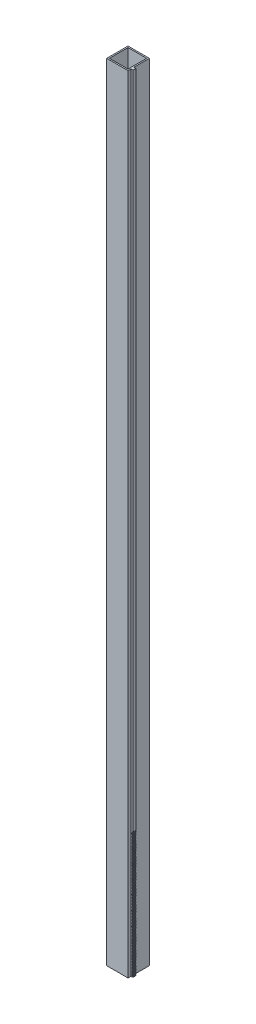
from build123d import *

# Parameters (mm, degrees)
SKETCH1_W            = 50.8
SKETCH1_H            = 50.8
BOSS_EXTRUDE1_DEPTH  = 1873.25
SHELL1_T             = -3.175
SKETCH3_W            = 7
SKETCH3_H            = 1873.25
BOSS_EXTRUDE2_DEPTH  = 5
CUT_EXTRUDE1_REACH   = 1876.302
LPATTERN1_COUNT      = 100
LPATTERN1_PITCH      = 3
LPATTERN1_COUNT_DIR2 = 2
LPATTERN1_PITCH_DIR2 = 3


with BuildPart() as part:
    # Sketch1 → Boss-Extrude1 (new body)
    with BuildSketch(Plane(origin=(0, 0, 0), x_dir=(1, 0, 0), z_dir=(0, 1, 0))):
        with Locations((-25.4, -25.4)):
            Rectangle(SKETCH1_W, SKETCH1_H)
    extrude(amount=BOSS_EXTRUDE1_DEPTH)

    # Shell1
    shell1_openings = [part.faces().sort_by_distance(p)[0] for p in [
        (-25.4, 0, 25.4),
        (-25.4, 1873.25, 25.4),
    ]]
    offset(amount=SHELL1_T, openings=shell1_openings, kind=Kind.INTERSECTION)

    # Sketch3 → Boss-Extrude2 (add)
    with BuildSketch(Plane(origin=(0, 0, 0), x_dir=(0, 0, -1), z_dir=(1, 0, 0))):
        with Locations((-40.388912864, 936.625)):
            Rectangle(SKETCH3_W, SKETCH3_H)
    extrude(amount=BOSS_EXTRUDE2_DEPTH)

    # Sketch4 → Cut-Extrude1 (cut, up to next)
    with BuildSketch(Plane(origin=(0, 0, 36.888912864), x_dir=(-1, 0, 0), z_dir=(0, 0, -1)), mode=Mode.PRIVATE) as cut_extrude1_sk1:
        Polygon((-5, 1.5), (-3, 2), (-3, 3), (-5, 3.5), align=None)
    cut_extrude1_tool1 = extrude(cut_extrude1_sk1.sketch, amount=-CUT_EXTRUDE1_REACH, mode=Mode.PRIVATE) & part.part
    cut_extrude1 = cut_extrude1_tool1.solids().sort_by_distance((4.111111, 2.5, 36.888913))[0]
    add(cut_extrude1, mode=Mode.SUBTRACT)

    # LPattern1: Cut-Extrude1 100 × 2
    with Locations(*[Vector(0, 1, 0) * (i * LPATTERN1_PITCH) + Vector(0, -1, 0) * (j * LPATTERN1_PITCH_DIR2) for i in range(LPATTERN1_COUNT) for j in range(LPATTERN1_COUNT_DIR2) if (i, j) != (0, 0)]):
        add(cut_extrude1, mode=Mode.SUBTRACT)


solid = part.part
